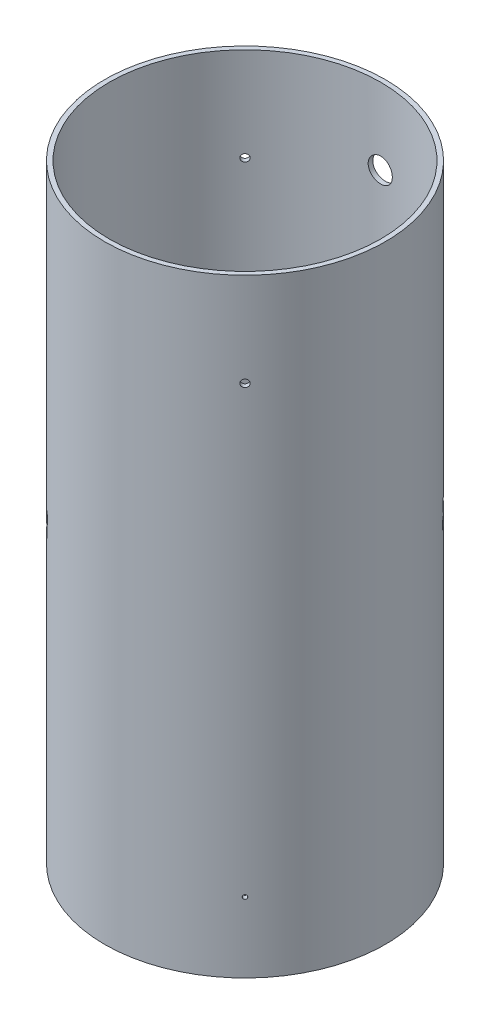
from build123d import *

# Parameters (mm, degrees)
SKETCH1_R                     = 76.1746
SKETCH1_R_2                   = 73.66
BOSS_EXTRUDE1_DEPTH           = 330.2
SKETCH23_R                    = 1.0922
SHEAR_SCRREWS_DEPTH           = 348.328633238
CIRPATTERN1_COUNT             = 4
SKETCH26_R                    = 2.7499945
SKETCH26_W                    = 6.99999997
SKETCH26_H                    = 10.000000066
UPWARDS_CAMERA_CUTOUT_DEPTH   = 348.328633238
SKETCH27_R                    = 2.7499945
SKETCH27_W                    = 6.99999997
SKETCH27_H                    = 10.000000066
DOWNWARDS_CAMERA_CUTOUT_DEPTH = 348.328633238
SKETCH28_R                    = 2.7499945
CUT_EXTRUDE4_DEPTH            = 348.328633238
CIRPATTERN3_COUNT             = 2
CIRPATTERN3_ANGLE             = 8.407249505
SKETCH29_R                    = 2.7499945
CUT_EXTRUDE5_DEPTH            = 348.328633238
CIRPATTERN4_COUNT             = 2
CIRPATTERN4_ANGLE             = 8.407249505
CIRPATTERN5_COUNT             = 4


with BuildPart() as part:
    # Sketch1 → Boss-Extrude1 (new body)
    with BuildSketch(Plane(origin=(0, 0, 0), x_dir=(1, 0, 0), z_dir=(0, 1, 0))):
        Circle(SKETCH1_R)
        Circle(SKETCH1_R_2, mode=Mode.SUBTRACT)
    extrude(amount=BOSS_EXTRUDE1_DEPTH)

    # Sketch17 → 1/2 Clearance Hole5 (revolve, cut)
    with BuildSketch(Plane(origin=(0, 288.925, 0), x_dir=(0, -1, 0), z_dir=(1, 0, 0))):
        Polygon((0, 0), (0, 80.134507437), (6.54812, 76.2), (6.54812, 0), align=None)
    revolve(axis=Axis((0, 288.925, 6.35), (0, 0, -1)), mode=Mode.SUBTRACT)

    # Sketch21 → 1/2 Clearance Hole7 (revolve, cut)
    with BuildSketch(Plane(origin=(0, 41.275, 0), x_dir=(0, -1, 0), z_dir=(1, 0, 0))):
        Polygon((0, 0), (0, 80.134507437), (6.54812, 76.2), (6.54812, 0), align=None)
    revolve(axis=Axis((0, 41.275, 6.35), (0, 0, -1)), mode=Mode.SUBTRACT)

    # Sketch23 → Shear Scrrews (cut, through all)
    with BuildSketch(Plane(origin=(0, 0, 0), x_dir=(0.7071067811865477, 0, 0.7071067811865475), z_dir=(-0.7071067811865475, 0, 0.7071067811865477))):
        with Locations((0, 38.1)):
            Circle(SKETCH23_R)
    shear_scrrews = extrude(amount=-SHEAR_SCRREWS_DEPTH, mode=Mode.SUBTRACT)

    # CirPattern1: Shear Scrrews ×4 about axis
    cirpattern1_axis = Axis((0, 330.2, 0), (0, -1, 0))
    for i in range(1, CIRPATTERN1_COUNT):
        add(shear_scrrews.rotate(cirpattern1_axis, i * 360 / CIRPATTERN1_COUNT), mode=Mode.SUBTRACT)

    # Sketch31 → Ø4.0 (4) Diameter Hole - Forward Tube Secure (revolve, cut)
    with BuildSketch(Plane(origin=(0, 279.4, 0), x_dir=(0.7071067811865464, 0, 0.7071067811865488), z_dir=(0, 1, 0))):
        Polygon((0, 0), (0, 90.101721238), (2, 88.9), (2, 0), align=None)
    f_4_0_4_diameter_hole_forward_tube_sec = revolve(axis=Axis((-4.490128061, 279.4, 4.490128061), (0.7071067811865487, 0, -0.7071067811865464)), mode=Mode.SUBTRACT)

    # Sketch26 → Upwards Camera Cutout (cut, through all)
    with BuildSketch(Plane(origin=(0, 0, 0), x_dir=(0, -1, 0), z_dir=(0.7071067811865488, 0, -0.7071067811865464))):
        with Locations((-158.73500003, 0)):
            Circle(SKETCH26_R)
        with Locations((-171.125000015, 0)):
            Rectangle(SKETCH26_W, SKETCH26_H)
    extrude(amount=UPWARDS_CAMERA_CUTOUT_DEPTH, mode=Mode.SUBTRACT)

    # Sketch27 → Downwards Camera Cutout (cut, through all)
    with BuildSketch(Plane(origin=(0, 0, 0), x_dir=(0, -1, 0), z_dir=(0.7071067811865488, 0, -0.7071067811865464))):
        with Locations((-171.46499997, 0)):
            Circle(SKETCH27_R)
        with Locations((-159.074999985, 0)):
            Rectangle(SKETCH27_W, SKETCH27_H)
    extrude(amount=-DOWNWARDS_CAMERA_CUTOUT_DEPTH, mode=Mode.SUBTRACT)

    # Sketch28 → Cut-Extrude4 (cut, through all)
    with BuildSketch(Plane(origin=(0, 0, 0), x_dir=(0, -1, 0), z_dir=(0.7567196876815192, 0, -0.6537394850207414))):
        with Locations((-166.38499997, 0)):
            Circle(SKETCH28_R)
    cut_extrude4 = extrude(amount=-CUT_EXTRUDE4_DEPTH, mode=Mode.SUBTRACT)

    # CirPattern3: Cut-Extrude4 ×2 about axis
    cirpattern3_axis = Axis((0, 0, 0), (0, 1, 0))
    for i in range(1, CIRPATTERN3_COUNT):
        add(cut_extrude4.rotate(cirpattern3_axis, i * CIRPATTERN3_ANGLE / (CIRPATTERN3_COUNT - 1)), mode=Mode.SUBTRACT)

    # Sketch29 → Cut-Extrude5 (cut, through all)
    with BuildSketch(Plane(origin=(0, 0, 0), x_dir=(0, -1, 0), z_dir=(0.7567196876815192, 0, -0.6537394850207414))):
        with Locations((-163.81500003, 0)):
            Circle(SKETCH29_R)
    cut_extrude5 = extrude(amount=CUT_EXTRUDE5_DEPTH, mode=Mode.SUBTRACT)

    # CirPattern4: Cut-Extrude5 ×2 about axis
    cirpattern4_axis = Axis((0, 330.2, 0), (0, 1, 0))
    for i in range(1, CIRPATTERN4_COUNT):
        add(cut_extrude5.rotate(cirpattern4_axis, i * CIRPATTERN4_ANGLE / (CIRPATTERN4_COUNT - 1)), mode=Mode.SUBTRACT)

    # CirPattern5: Ø4.0 (4) Diameter Hole - Forward Tube Secure ×4 about axis
    cirpattern5_axis = Axis((0, 330.2, 0), (0, 1, 0))
    for i in range(1, CIRPATTERN5_COUNT):
        add(f_4_0_4_diameter_hole_forward_tube_sec.rotate(cirpattern5_axis, i * 360 / CIRPATTERN5_COUNT), mode=Mode.SUBTRACT)


solid = part.part
